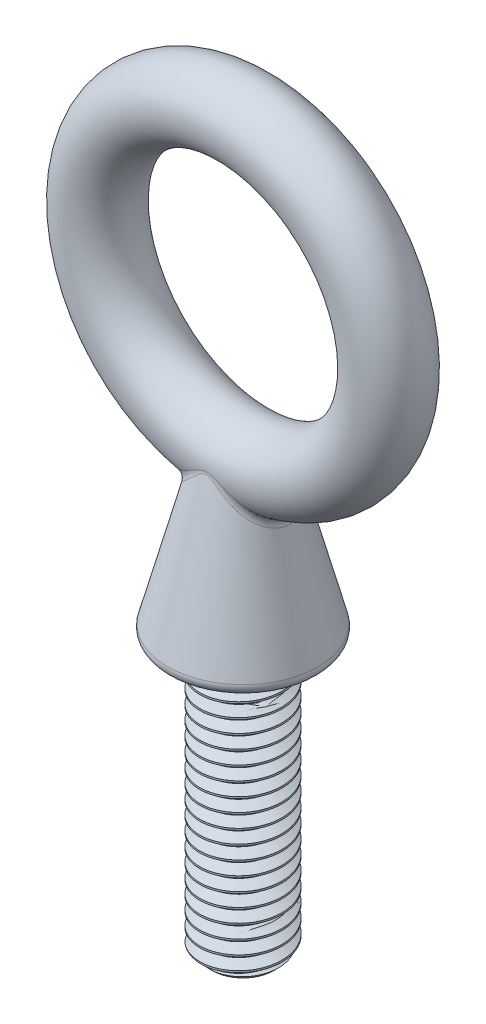
from build123d import *
from build123d.topology import SkipClean

# Parameters (mm, degrees)
BOSS_EXTRUDE1_START = -35.321875
SKETCH2_R           = 4.7625
BOSS_EXTRUDE1_DEPTH = 31.75
CUT_SWEEP1_PITCH    = 1.5875
SKETCH5_OUTSIDE_W   = 85.336
SKETCH5_OUTSIDE_H   = 85.336
SKETCH5_OUTSIDE_R   = 3.559536588
CUT_EXTRUDE1_DEPTH  = 33.456514304
CUT_EXTRUDE1_DRAFT  = -45
SKETCH6_R           = 4.1671875
FILLET1_R           = 1.041796875


with BuildPart() as part:
    # Sketch2 → Boss-Extrude1 (new body)
    with BuildSketch(Plane(origin=(0, 0, 0), x_dir=(1, 0, 0), z_dir=(0, 1, 0)).offset(BOSS_EXTRUDE1_START)):
        with Locations(Location((0, 0, 0), (0, 0, 270))):
            Circle(SKETCH2_R)
    extrude(amount=-BOSS_EXTRUDE1_DEPTH)

    # Cut-Sweep1: the profile of Sketch4 screwed along a right-hand helix of 21 turns, 8 arcs to a turn; built about Z, then put on its axis
    cut_sweep1_z = Axis((0, 0, 0), (0, 0, 1))
    cut_sweep1_corners = [(4.848425958, 0, 0.049609375), (3.731388504, 0, -0.5953125), (3.731388504, 0, -0.79375), (4.848425958, 0, -1.438671875)]
    with BuildLine(mode=Mode.PRIVATE) as cut_sweep1_profile:
        Line(cut_sweep1_corners[0], cut_sweep1_corners[1])
        Line(cut_sweep1_corners[1], cut_sweep1_corners[2])
        Line(cut_sweep1_corners[2], cut_sweep1_corners[3])
        Line(cut_sweep1_corners[3], cut_sweep1_corners[0])
    cut_sweep1_cap = Face(cut_sweep1_profile.wire())
    cut_sweep1_turn_angles = [0, 22.5, 45, 67.5, 90, 112.5, 135, 157.5, 180, 202.5, 225, 247.5, 270, 292.5, 315, 337.5, 360]
    cut_sweep1_turn_weights = [1, 0.9238795325112867, 1, 0.9238795325112867, 1, 0.9238795325112867, 1, 0.9238795325112867, 1, 0.9238795325112867, 1, 0.9238795325112867, 1, 0.9238795325112867, 1, 0.9238795325112867, 1]
    cut_sweep1_turn_rails = [Edge.make_bspline([Vector(p[0], p[1], 0).rotate(cut_sweep1_z, cut_sweep1_turn_angles[k]) / cut_sweep1_turn_weights[k] + Vector(0, 0, p[2] + CUT_SWEEP1_PITCH * cut_sweep1_turn_angles[k] / 360) for k in range(17)], [0, 0, 0, 1, 1, 2, 2, 3, 3, 4, 4, 5, 5, 6, 6, 7, 7, 8, 8, 8], 2, cut_sweep1_turn_weights) for p in cut_sweep1_corners]
    cut_sweep1_turn_sides = [Face.make_surface_from_curves(cut_sweep1_turn_rails[p[0]], cut_sweep1_turn_rails[p[1]]) for p in [(0, 1), (1, 2), (2, 3), (3, 0)]]
    cut_sweep1 = Plane(origin=(0, -67.071875, 0), x_dir=(1, 0, 0), z_dir=(0, 1, 0)) * Solid(Shell([*[p.moved(Location((0, 0, CUT_SWEEP1_PITCH * i))) for i in range(21) for p in cut_sweep1_turn_sides], cut_sweep1_cap, cut_sweep1_cap.rotate(cut_sweep1_z, 7560).moved(Location((0, 0, CUT_SWEEP1_PITCH * 7560 / 360)))]))
    add(cut_sweep1, mode=Mode.SUBTRACT)


with BuildPart() as cut_extrude1_tool:
    # Sketch5 outside → Cut-Extrude1 (with draft: the straight prism first)
    with BuildSketch(Plane.XZ.offset(67.071875)):
        Rectangle(SKETCH5_OUTSIDE_W, SKETCH5_OUTSIDE_H)
        Circle(SKETCH5_OUTSIDE_R, mode=Mode.SUBTRACT)
    extrude(amount=-CUT_EXTRUDE1_DEPTH)
    # Cut-Extrude1: the draft: its side faces are tilted about the plane it starts from
    cut_extrude1_sides = [cut_extrude1_tool.faces().sort_by_distance(p)[0] for p in [
        (0, -50.343617848, -42.668),
        (42.668, -50.343617848, 0),
        (0, -50.343617848, 42.668),
        (-42.668, -50.343617848, 0),
        (-3.559536588, -50.343617848, 0),
    ]]
    draft(cut_extrude1_sides, Plane.XZ.offset(67.071875), CUT_EXTRUDE1_DRAFT)


with BuildPart() as part_1:
    add(part.part)

    # Cut-Extrude1: cut by cut_extrude1_tool
    add(cut_extrude1_tool.part, mode=Mode.SUBTRACT)



with BuildPart() as body_2:
    # Sketch6 → Revolve1 (revolve)
    with BuildSketch(Plane(origin=(0, 0, 0), x_dir=(0, 0, -1), z_dir=(1, 0, 0)), mode=Mode.PRIVATE) as revolve1_sk:
        with Locations((0, 16.8671875)):
            Circle(SKETCH6_R)
    revolve(revolve1_sk.sketch.rotate(Axis((0, 0, -7.63984375), (0, 0, 1)), 90), axis=Axis((0, 0, -7.63984375), (0, 0, 1)))


with BuildPart() as part_2:
    with SkipClean():  # the faces are left unmerged after this step: merging them gives an invalid solid
        add(part_1.part)

        add(body_2.part)  # Revolve2 merges body 2
        # Sketch8 → Revolve2 (revolve)
        with BuildSketch(Plane.XY, mode=Mode.PRIVATE) as revolve2_sk:
            with BuildLine():
                Line((0, -35.321875), (0, -16.8671875))
                Line((0, -16.8671875), (-4.1671875, -16.8671875))
                Line((-4.1671875, -16.8671875), (-8.696699364, -34.014003432))
                ThreePointArc((-8.696699364, -34.014003432), (-8.514842885, -34.915745076), (-7.689453125, -35.321875))
                Line((-7.689453125, -35.321875), (0, -35.321875))
            make_face()
        revolve(revolve2_sk.sketch.rotate(Axis((0, -35.321875, 0), (0, 1, 0)), 180), axis=Axis((0, -35.321875, 0), (0, 1, 0)))

    # Fillet1
    fillet1_edges = [part_2.edges().sort_by_distance(p)[0] for p in [
        (3.36717004, -19.05792962, 3.344500871),
    ]]
    fillet(fillet1_edges, radius=FILLET1_R)


solid = part_2.part
